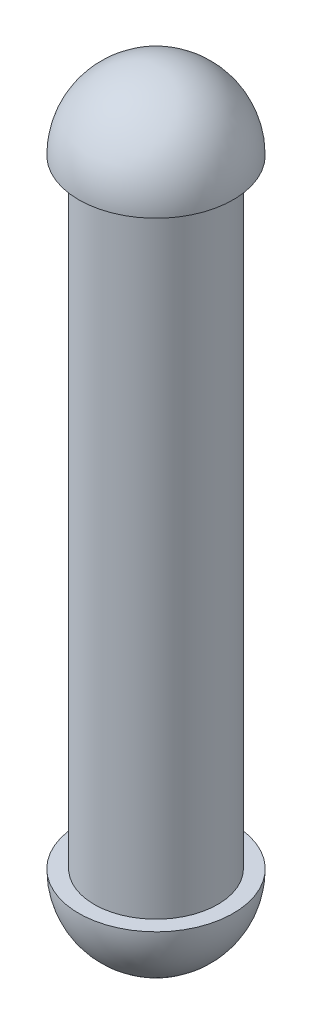
from build123d import *

# Parameters (mm, degrees)
SZKIC1_R                    = 4
DODANIE_WYCI_GNI_CIE1_DEPTH = 40
SZKIC2_R                    = 5
DODANIE_WYCI_GNI_CIE2_DEPTH = 5
ZAOKR_GLENIE1_R             = 5
DODANIE_WYCI_GNI_CIE3_START = 5
SZKIC3_R                    = 5
DODANIE_WYCI_GNI_CIE3_DEPTH = 5
ZAOKR_GLENIE2_R             = 5


with BuildPart() as part:
    # Szkic1 → Dodanie-wyciągnięcie1 (new body)
    with BuildSketch(Plane(origin=(0, 0, 0), x_dir=(1, 0, 0), z_dir=(0, 1, 0))):
        with Locations(Location((0, 0, 0), (0, 0, 270))):
            Circle(SZKIC1_R)
    extrude(amount=DODANIE_WYCI_GNI_CIE1_DEPTH)

    # Szkic2 → Dodanie-wyciągnięcie2 (add)
    with BuildSketch(Plane(origin=(0, 40, 0), x_dir=(1, 0, 0), z_dir=(0, 1, 0))):
        with Locations(Location((0, 0, 0), (0, 0, 270))):
            Circle(SZKIC2_R)
    extrude(amount=DODANIE_WYCI_GNI_CIE2_DEPTH)

    # Zaokrąglenie1
    zaokr_glenie1_edges = [part.edges().sort_by_distance(p)[0] for p in [
        (0, 45, -5),
    ]]
    fillet(zaokr_glenie1_edges, radius=ZAOKR_GLENIE1_R - 0.0001)  # a hair under: the kernel refuses the full size

    # Szkic3 → Dodanie-wyciągnięcie3 (add)
    with BuildSketch(Plane.XZ.offset(DODANIE_WYCI_GNI_CIE3_START)):
        with Locations(Location((0, 0, 0), (0, 0, 270))):
            Circle(SZKIC3_R)
    extrude(amount=-DODANIE_WYCI_GNI_CIE3_DEPTH)

    # Zaokrąglenie2
    zaokr_glenie2_edges = [part.edges().sort_by_distance(p)[0] for p in [
        (0, -5, 5),
    ]]
    fillet(zaokr_glenie2_edges, radius=ZAOKR_GLENIE2_R - 0.0001)  # a hair under: the kernel refuses the full size


solid = part.part
